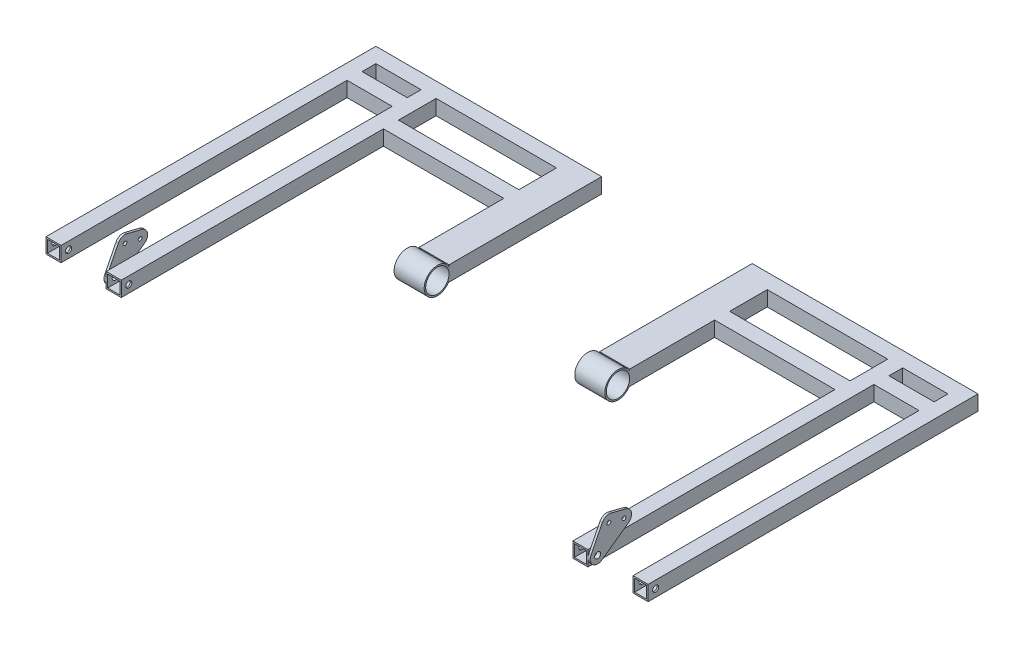
from build123d import *

# Parameters (mm, degrees)
BOSS_EXTRUDE1_START = 100
SKETCH4_R           = 17.5
SKETCH4_R_2         = 15.5
BOSS_EXTRUDE1_DEPTH = 40
BOSS_EXTRUDE2_START = -110
SKETCH5_W           = 60
SKETCH5_H           = 18.3
SKETCH5_W_2         = 160
SKETCH5_H_2         = 50
BOSS_EXTRUDE2_DEPTH = 20
SHELL1_START        = 102
SHELL1_DEPTH        = 36
SHELL1_START_2      = 302
SHELL1_2_OUTLINE_W  = 16
SHELL1_2_OUTLINE_H  = 436.3
SHELL1_2_DEPTH      = 16
SHELL1_START_3      = 382
SHELL1_3_OUTLINE_W  = 16
SHELL1_3_OUTLINE_H  = 436.3
SHELL1_3_DEPTH      = 16
SHELL1_START_4      = 138
SHELL1_4_OUTLINE_W  = 16
SHELL1_4_OUTLINE_H  = 16
SHELL1_4_DEPTH      = 164
SHELL1_START_5      = 318
SHELL1_5_OUTLINE_W  = 16
SHELL1_5_OUTLINE_H  = 16
SHELL1_5_DEPTH      = 64
SKETCH7_R           = 4
CUT_EXTRUDE1_DEPTH  = 115
BOSS_EXTRUDE3_START = 3
SKETCH8_R           = 2.5
SKETCH8_R_2         = 4
BOSS_EXTRUDE3_DEPTH = 3


# Read off the part's stored shape, not the designer's step: Shell1
with BuildPart() as part:
    # Sketch4 → Boss-Extrude1 (new body)
    with BuildSketch(Plane(origin=(0, 0, 0), x_dir=(0, 0, -1), z_dir=(1, 0, 0)).offset(BOSS_EXTRUDE1_START)):
        with Locations((0, -120.5)):
            Circle(SKETCH4_R)
        with Locations((0, -120.5)):
            Circle(SKETCH4_R_2, mode=Mode.SUBTRACT)
    extrude(amount=BOSS_EXTRUDE1_DEPTH)

    # Sketch5 → Boss-Extrude2 (add)
    with BuildSketch(Plane(origin=(0, 0, 0), x_dir=(1, 0, 0), z_dir=(0, 1, 0)).offset(BOSS_EXTRUDE2_START)):
        Polygon((320, 160), (380, 160), (380, -220), (400, -220), (400, 218.3), (360, 218.3), (340, 218.3), (100, 218.3), (100, 15.5), (140, 15.5), (140, 128.3), (300, 128.3), (300, -220), (320, -220), align=None)
        with Locations((350, 189.15)):
            Rectangle(SKETCH5_W, SKETCH5_H, mode=Mode.SUBTRACT)
        with Locations((220, 173.3)):
            Rectangle(SKETCH5_W_2, SKETCH5_H_2, mode=Mode.SUBTRACT)
    extrude(amount=-BOSS_EXTRUDE2_DEPTH)

    # Shell1 outline → Shell1 (cut)
    with BuildSketch(Plane.YZ.offset(SHELL1_START)):
        with BuildLine():
            ThreePointArc((-112, -18.654758106), (-119.95690747, -20.492804847), (-128, -19.078784028))
            Line((-128, -19.078784028), (-128, -216.3))
            Line((-128, -216.3), (-112, -216.3))
            Line((-112, -216.3), (-112, -18.654758106))
        make_face()
    extrude(amount=SHELL1_DEPTH, mode=Mode.SUBTRACT)

    # Shell1 2 outline → Shell1 2 (cut)
    with BuildSketch(Plane.YZ.offset(SHELL1_START_2)):
        with Locations((-120, 1.85)):
            Rectangle(SHELL1_2_OUTLINE_W, SHELL1_2_OUTLINE_H)
    extrude(amount=SHELL1_2_DEPTH, mode=Mode.SUBTRACT)

    # Shell1 3 outline → Shell1 3 (cut)
    with BuildSketch(Plane.YZ.offset(SHELL1_START_3)):
        with Locations((-120, 1.85)):
            Rectangle(SHELL1_3_OUTLINE_W, SHELL1_3_OUTLINE_H)
    extrude(amount=SHELL1_3_DEPTH, mode=Mode.SUBTRACT)

    # Shell1 4 outline → Shell1 4 (cut)
    with BuildSketch(Plane.YZ.offset(SHELL1_START_4)):
        with Locations((-120, -138.3)):
            Rectangle(SHELL1_4_OUTLINE_W, SHELL1_4_OUTLINE_H)
        with Locations((-120, -208.3)):
            Rectangle(SHELL1_4_OUTLINE_W, SHELL1_4_OUTLINE_H)
    extrude(amount=SHELL1_4_DEPTH, mode=Mode.SUBTRACT)

    # Shell1 5 outline → Shell1 5 (cut)
    with BuildSketch(Plane.YZ.offset(SHELL1_START_5)):
        with Locations((-120, -170)):
            Rectangle(SHELL1_5_OUTLINE_W, SHELL1_5_OUTLINE_H)
        with Locations((-120, -208.3)):
            Rectangle(SHELL1_5_OUTLINE_W, SHELL1_5_OUTLINE_H)
    extrude(amount=SHELL1_5_DEPTH, mode=Mode.SUBTRACT)

    # Sketch7 → Cut-Extrude1 (cut)
    with BuildSketch(Plane(origin=(400, 0, 0), x_dir=(0, 0, -1), z_dir=(1, 0, 0))):
        with Locations((-210, -120)):
            Circle(SKETCH7_R)
    extrude(amount=-CUT_EXTRUDE1_DEPTH, mode=Mode.SUBTRACT)

    # Sketch8 → Boss-Extrude3 (add)
    with BuildSketch(Plane(origin=(320, 0, 0), x_dir=(0, 0, -1), z_dir=(1, 0, 0)).offset(BOSS_EXTRUDE3_START)):
        with BuildLine():
            Line((-204.187618063, -128.137334712), (-169.187618063, -103.137334712))
            ThreePointArc((-169.187618063, -103.137334712), (-165.17551937, -93.134636668), (-172.57464375, -85.298574999))
            Line((-172.57464375, -85.298574999), (-192.57464375, -80.298574999))
            ThreePointArc((-192.57464375, -80.298574999), (-199.178568095, -80.914871015), (-203.94427191, -85.527864045))
            Line((-203.94427191, -85.527864045), (-218.94427191, -115.527864045))
            ThreePointArc((-218.94427191, -115.527864045), (-216.496296739, -127.602508052), (-204.187618063, -128.137334712))
        make_face()
        with Locations((-195, -90)):
            Circle(SKETCH8_R, mode=Mode.SUBTRACT)
        with Locations((-175, -95)):
            Circle(SKETCH8_R, mode=Mode.SUBTRACT)
        with Locations((-210, -120)):
            Circle(SKETCH8_R_2, mode=Mode.SUBTRACT)
    extrude(amount=-BOSS_EXTRUDE3_DEPTH)


with BuildPart() as body_2:
    # Mirror3: mirrored copy
    add(part.part.mirror(Plane(origin=(0, 0, 0), x_dir=(0, 0, 1), z_dir=(1, 0, 0))))


solid = Compound([part.part, body_2.part])
